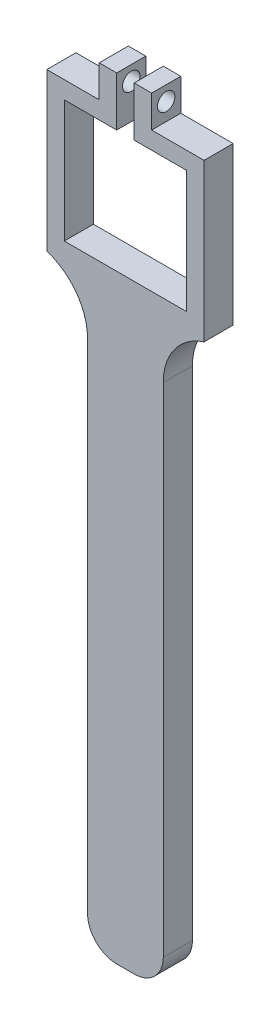
from build123d import *

# Parameters (mm, degrees)
BOSS_EXTRUDE1_DEPTH = 5
FILLET1_R           = 10
FILLET2_R           = 5
SKETCH3_R           = 1.5
CUT_EXTRUDE1_DEPTH  = 15


with BuildPart() as part:
    # Sketch1 → Boss-Extrude1 (new body)
    with BuildSketch(Plane.XY):
        Polygon((4.681102362, -8.657480315), (11.681102362, -8.657480315), (11.681102362, 18.342519685), (2.681102362, 18.342519685), (2.681102362, 23.842519685), (-0.318897638, 23.842519685), (-0.318897638, 18.342519685), (-0.318897638, 15.342519685), (8.681102362, 15.342519685), (8.681102362, -5.657480315), (-12.318897638, -5.657480315), (-12.318897638, 15.342519685), (-3.318897638, 15.342519685), (-3.318897638, 18.342519685), (-3.318897638, 23.842519685), (-6.318897638, 23.842519685), (-6.318897638, 18.342519685), (-15.318897638, 18.342519685), (-15.318897638, -8.657480315), (-8.318897638, -8.657480315), (-8.318897638, -108.657480315), (4.681102362, -108.657480315), align=None)
    extrude(amount=BOSS_EXTRUDE1_DEPTH)

    # Fillet1
    # the kernel refuses this fillet: 10 mm, written as the material it adds along each edge
    with BuildSketch(Plane(origin=(-8.318897638, -8.657480315, 0), x_dir=(0, -1, 0), z_dir=(0, 0, 1))) as fillet1_piece_1:
        with BuildLine():
            CenterArc((9.539392014, -10), FILLET1_R, 90, 72.542396876)
            Line((0, -7), (-0.19078784, -6.94))
            ThreePointArc((-0.19078784, -6.94), (-0.2, -3.5), (-0.2, 0))
            Line((-0.2, 0), (0, 0.2))
            Line((0, 0.2), (9.539392014, 0.2))
            Line((9.539392014, 0.2), (9.539392014, 0))
        make_face()
    extrude(amount=5)
    with BuildSketch(Plane(origin=(4.681102362, -8.657480315, 0), x_dir=(1, 0, 0), z_dir=(0, 0, 1))) as fillet1_piece_2:
        with BuildLine():
            CenterArc((10, -9.539392014), FILLET1_R, 107.457603124, 72.542396876)
            Line((0, -9.539392014), (-0.2, -9.539392014))
            Line((-0.2, -9.539392014), (-0.2, 0))
            Line((-0.2, 0), (0, 0.2))
            ThreePointArc((0, 0.2), (3.5, 0.2), (6.94, 0.19078784))
            Line((6.94, 0.19078784), (7, 0))
        make_face()
    extrude(amount=5)

    # Fillet2
    fillet2_edges = [part.edges().sort_by_distance(p)[0] for p in [
        (4.681102362, -108.657480315, 2.5),
        (-8.318897638, -108.657480315, 2.5),
    ]]
    fillet(fillet2_edges, radius=FILLET2_R)

    # Sketch3 → Cut-Extrude1 (cut)
    with BuildSketch(Plane.ZY.offset(6.318897638)):
        with Locations(Location((2.5, 21.342519685, 0), (0, 0, 90))):
            Circle(SKETCH3_R)
    extrude(amount=-CUT_EXTRUDE1_DEPTH, mode=Mode.SUBTRACT)


solid = part.part
